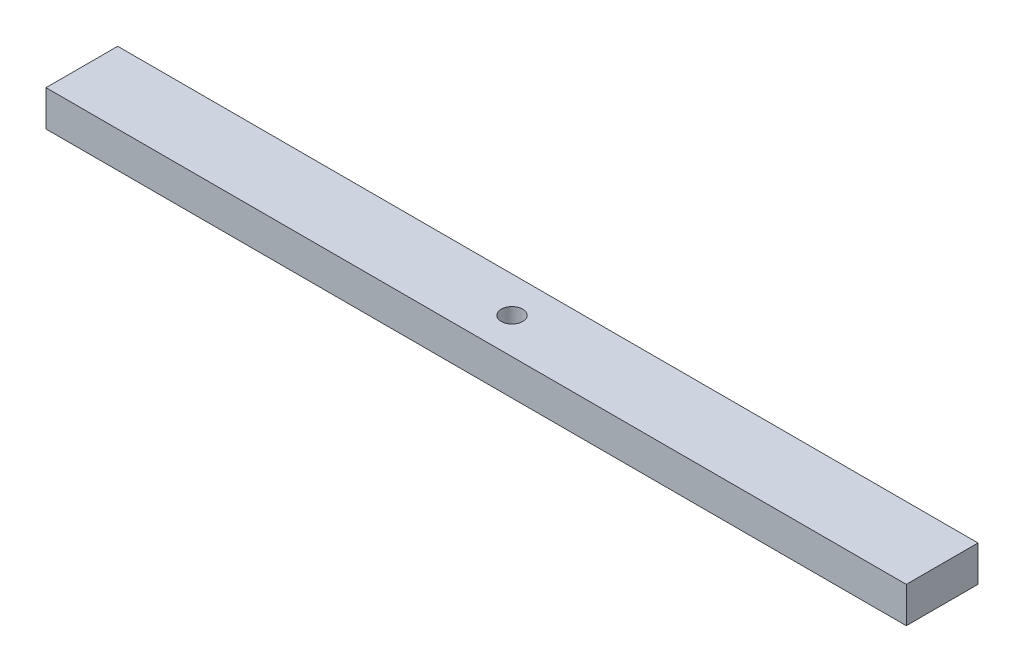
from build123d import *

# Parameters (mm, degrees)
SKETCH2_W           = 152.4
SKETCH2_H           = 12.7
BOSS_EXTRUDE1_DEPTH = 6.35
SKETCH3_R           = 1.89865
CUT_EXTRUDE1_DEPTH  = 77.727341932


with BuildPart() as part:
    # Sketch2 → Boss-Extrude1 (new body)
    with BuildSketch(Plane(origin=(0, 0, 0), x_dir=(1, 0, 0), z_dir=(0, 1, 0))):
        Rectangle(SKETCH2_W, SKETCH2_H)
    extrude(amount=BOSS_EXTRUDE1_DEPTH)

    # Sketch3 → Cut-Extrude1 (cut, through all)
    with BuildSketch(Plane.XZ):
        Circle(SKETCH3_R)
    extrude(amount=-CUT_EXTRUDE1_DEPTH, mode=Mode.SUBTRACT)


solid = part.part
